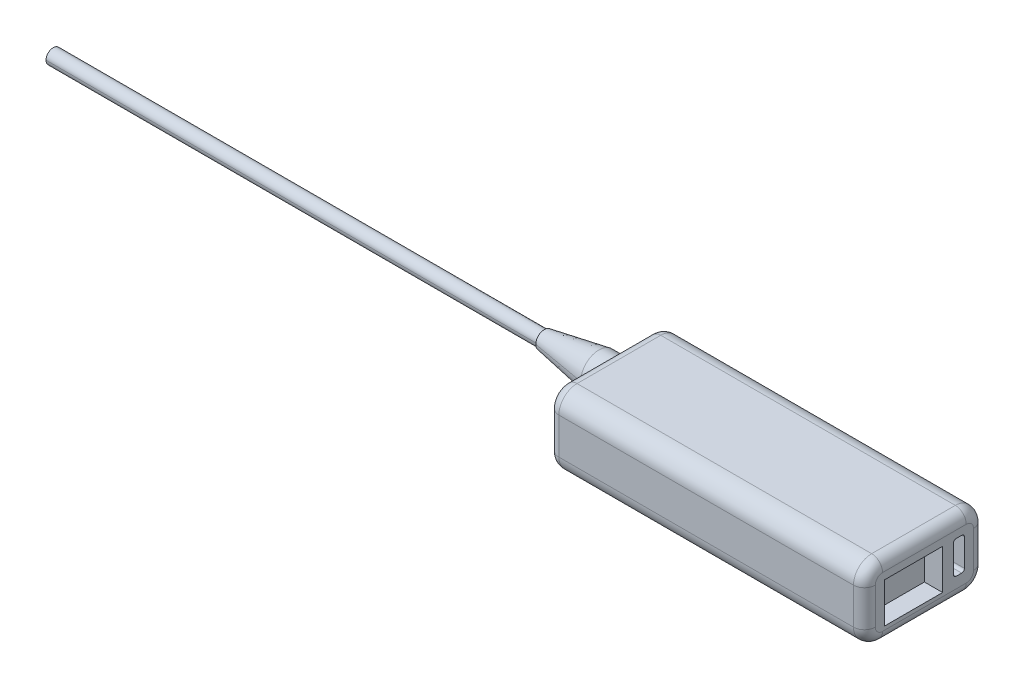
from build123d import *

# Parameters (mm, degrees)
SKETCH1_W           = 87
SKETCH1_H           = 33
BOSS_EXTRUDE1_DEPTH = 20
SKETCH3_W           = 16
SKETCH3_H           = 12
CUT_EXTRUDE1_DEPTH  = 9
SKETCH4_R           = 5
BOSS_EXTRUDE2_DEPTH = 35
SKETCH5_R           = 2
BOSS_EXTRUDE3_DEPTH = 135
SKETCH6_W           = 16
SKETCH6_H           = 11
CUT_EXTRUDE2_DEPTH  = 5
FILLET1_R           = 5
FILLET2_R           = 3
FILLET3_R           = 1
CHAMFER2_SIZE       = 15
CHAMFER2_SIZE2      = 2.644904711


with BuildPart() as part:
    # Sketch1 → Boss-Extrude1 (new body)
    with BuildSketch(Plane(origin=(0, 0, 0), x_dir=(1, 0, 0), z_dir=(0, 1, 0))):
        with Locations((43.5, 16.5)):
            Rectangle(SKETCH1_W, SKETCH1_H)
    extrude(amount=BOSS_EXTRUDE1_DEPTH)

    # Sketch3 → Cut-Extrude1 (cut)
    with BuildSketch(Plane.ZY):
        with Locations((-25, 6)):
            Rectangle(SKETCH3_W, SKETCH3_H)
    extrude(amount=-CUT_EXTRUDE1_DEPTH, mode=Mode.SUBTRACT)

    # Sketch4 → Boss-Extrude2 (add)
    with BuildSketch(Plane.ZY.offset(-9)):
        with Locations(Location((-25, 6, 0), (0, 0, 180))):
            Circle(SKETCH4_R)
    extrude(amount=BOSS_EXTRUDE2_DEPTH)

    # Sketch5 → Boss-Extrude3 (add)
    with BuildSketch(Plane.ZY.offset(26)):
        with Locations((-25, 6)):
            Circle(SKETCH5_R)
    extrude(amount=BOSS_EXTRUDE3_DEPTH)

    # Sketch6 → Cut-Extrude2 (cut)
    with BuildSketch(Plane(origin=(87, 0, 0), x_dir=(0, 0, -1), z_dir=(1, 0, 0))):
        with Locations((13.5, 9.5)):
            Rectangle(SKETCH6_W, SKETCH6_H)
        with BuildLine():
            Line((25.25, 15), (26.75, 15))
            ThreePointArc((26.75, 15), (27.280330086, 14.780330086), (27.5, 14.25))
            Line((27.5, 14.25), (27.5, 6.75))
            ThreePointArc((27.5, 6.75), (27.280330086, 6.219669914), (26.75, 6))
            Line((26.75, 6), (25.25, 6))
            ThreePointArc((25.25, 6), (24.719669914, 6.219669914), (24.5, 6.75))
            Line((24.5, 6.75), (24.5, 14.25))
            ThreePointArc((24.5, 14.25), (24.719669914, 14.780330086), (25.25, 15))
        make_face()
    extrude(amount=-CUT_EXTRUDE2_DEPTH, mode=Mode.SUBTRACT)

    # Fillet1
    fillet1_edges = [part.edges().sort_by_distance(p)[0] for p in [
        (43.5, 20, -33),
        (48, 0, -33),
        (43.5, 0, 0),
        (43.5, 20, 0),
    ]]
    fillet(fillet1_edges, radius=FILLET1_R)

    # Fillet2
    fillet2_edges = [part.edges().sort_by_distance(p)[0] for p in [
        (0, 0, -11),
        (0, 20, -16.5),
        (87, 20, -16.5),
        (0, 10, 0),
        (0, 13.5, -33),
        (0, 1.464466094, -1.464466094),
        (0, 18.535533906, -1.464466094),
        (0, 18.535533906, -31.535533906),
        (87, 10, -33),
        (87, 0, -16.5),
        (87, 10, 0),
        (87, 1.464466094, -31.535533906),
        (87, 1.464466094, -1.464466094),
        (87, 18.535533906, -1.464466094),
        (87, 18.535533906, -31.535533906),
    ]]
    fillet(fillet2_edges, radius=FILLET2_R)

    # Fillet3
    fillet3_edges = [part.edges().sort_by_distance(p)[0] for p in [
        (0, 7.5, -17),
        (0.878679656, 12, -32.121320344),
        (0.878679656, 0.878679656, -17),
        (9, 8.5, -33),
        (9, 12, -25),
        (6, 12, -33),
        (9, 6, -17),
        (6, 0, -17),
        (0, 12, -23.5),
        (9, 0, -22.5),
        (9, 1.464466094, -31.535533906),
    ]]
    fillet(fillet3_edges, radius=FILLET3_R - 0.0001)  # a hair under: the kernel refuses the full size

    # Chamfer2
    chamfer2_edges = [part.edges().sort_by_distance(p)[0] for p in [
        (-26, 6, -20),
    ]]
    chamfer2_side = [part.faces().sort_by_distance(p)[0] for p in [
        (-8.5, 6, -20),
    ]]
    chamfer(chamfer2_edges, length=CHAMFER2_SIZE, length2=CHAMFER2_SIZE2, reference=chamfer2_side[0])


solid = part.part
